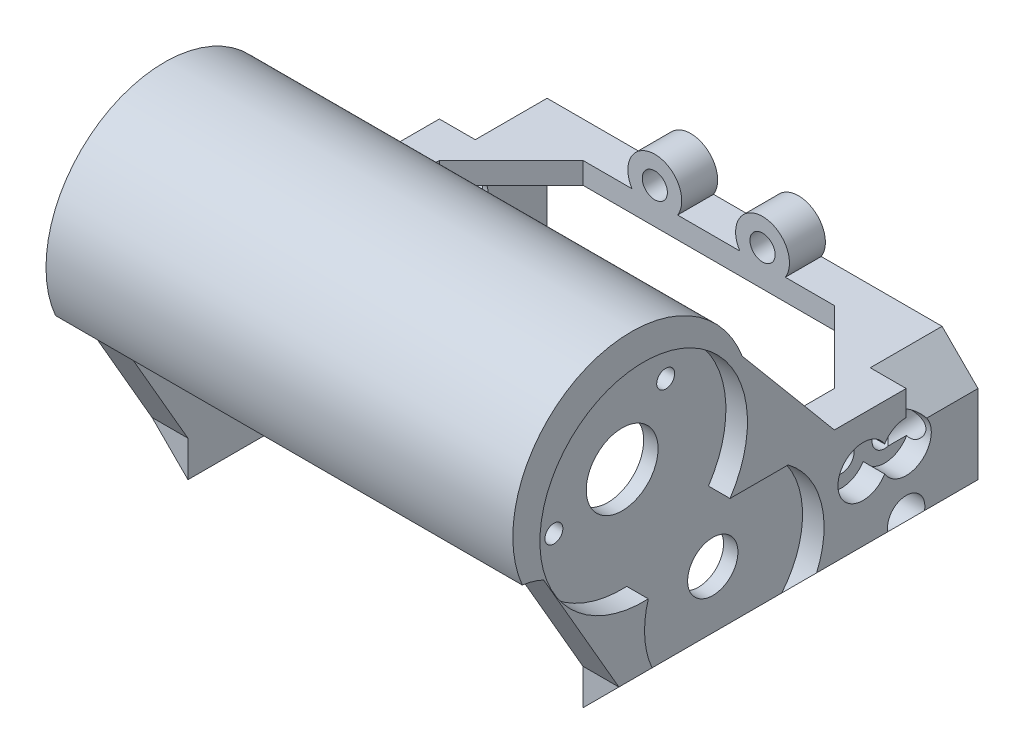
from build123d import *

# Parameters (mm, degrees)
SKETCH1_R           = 5
SKETCH1_R_2         = 1.25
SKETCH1_R_3         = 3.5
SKETCH1_R_4         = 1.75
SKETCH1_R_5         = 2.6
BOSS_EXTRUDE1_DEPTH = 5
CUT_EXTRUDE12_DEPTH = 3
CUT_EXTRUDE15_REACH = 72.749
BOSS_EXTRUDE2_START = -65
SKETCH7_W           = 5
SKETCH7_H           = 3
BOSS_EXTRUDE2_DEPTH = 65
SKETCH8_R           = 1.75
CUT_EXTRUDE16_DEPTH = 10
SKETCH10_R          = 3.75
SKETCH10_R_2        = 1.75
BOSS_EXTRUDE3_DEPTH = 5
CHAMFER1_SIZE       = 10


with BuildPart() as part:
    # Sketch1 → Boss-Extrude1 (new body)
    with BuildSketch(Plane(origin=(0, 0, 0), x_dir=(0, 0, -1), z_dir=(1, 0, 0))):
        with BuildLine():
            Line((-3.451085907, -28.022543867), (46.548914093, -28.022543867))
            Line((46.548914093, -28.022543867), (46.548914093, -7.022543867))
            Line((46.548914093, -7.022543867), (26.548914093, -7.022543867))
            Line((26.548914093, -7.022543867), (13.706594967, 8.30960665))
            ThreePointArc((13.706594967, 8.30960665), (-7.876735811, 17.766067564), (-16.904643834, -4))
            ThreePointArc((-16.904643834, -4), (-15.383939757, -4.319460395), (-13.931085907, -4.870651404))
            Line((-13.931085907, -4.870651404), (-3.451085907, -23.022543867))
            Line((-3.451085907, -23.022543867), (-3.451085907, -28.022543867))
        make_face()
        Circle(SKETCH1_R, mode=Mode.SUBTRACT)
        with Locations((6.061215112, 7.906432278)):
            Circle(SKETCH1_R_2, mode=Mode.SUBTRACT)
        with Locations((-9.50267373, -2.991520012)):
            Circle(SKETCH1_R_2, mode=Mode.SUBTRACT)
        with Locations((12.6186816, -18.021344974)):
            Circle(SKETCH1_R_3, mode=Mode.SUBTRACT)
        with Locations((36.548914093, -14.022543867)):
            Circle(SKETCH1_R_4, mode=Mode.SUBTRACT)
        with Locations((30.548914093, -14.022543867)):
            Circle(SKETCH1_R_4, mode=Mode.SUBTRACT)
        with Locations((36.548914093, -22.522543867)):
            Circle(SKETCH1_R_5, mode=Mode.SUBTRACT)
    boss_extrude1 = extrude(amount=BOSS_EXTRUDE1_DEPTH)

    # Sketch2 → Cut-Extrude12 (cut)
    with BuildSketch(Plane(origin=(5, 0, 0), x_dir=(0, 0, -1), z_dir=(1, 0, 0))):
        with BuildLine():
            Line((9.1186816, -30.021344974), (16.1186816, -30.021344974))
            ThreePointArc((16.1186816, -30.021344974), (24.917055476, -20.257412952), (20.1186816, -8.021344974))
            Line((20.1186816, -8.021344974), (12.019173216, -8.021344974))
            ThreePointArc((12.019173216, -8.021344974), (-7.097524936, 12.586804193), (0.644011182, -14.435641641))
            ThreePointArc((0.644011182, -14.435641641), (1.637110982, -23.992534703), (9.1186816, -30.021344974))
        make_face()
        with BuildLine():
            ThreePointArc((33.548914093, -15.825319505), (40.048914093, -14.022543867), (33.548914093, -12.219768229))
            ThreePointArc((33.548914093, -12.219768229), (27.048914093, -14.022543867), (33.548914093, -15.825319505))
        make_face()
    cut_extrude12 = extrude(amount=-CUT_EXTRUDE12_DEPTH, mode=Mode.SUBTRACT)

    # Sketch6 → Cut-Extrude15 (cut, up to next)
    with BuildSketch(Plane(origin=(0, 0, -46.548914093), x_dir=(-1, 0, 0), z_dir=(0, 0, -1)), mode=Mode.PRIVATE) as cut_extrude15_sk1:
        Polygon((0, -28.022543867), (-5, -23.022543867), (-6.777242855, -29.799786723), align=None)
    cut_extrude15_tool1 = extrude(cut_extrude15_sk1.sketch, amount=-CUT_EXTRUDE15_REACH, mode=Mode.PRIVATE) & part.part
    cut_extrude15 = cut_extrude15_tool1.solids().sort_by_distance((3.925748, -26.948291, -46.548914))[0]
    add(cut_extrude15, mode=Mode.SUBTRACT)

    # Sketch7 → Boss-Extrude2 (add)
    with BuildSketch(Plane(origin=(5, 0, 0), x_dir=(0, 0, -1), z_dir=(1, 0, 0)).offset(BOSS_EXTRUDE2_START)):
        with BuildLine():
            Line((-13.931085907, -4.870651404), (-13.604383665, -4.870651404))
            ThreePointArc((-13.604383665, -4.870651404), (-6.212314592, 13.046441944), (12.35657784, 7.491160397))
            Line((12.35657784, 7.491160397), (13.706594967, 8.30960665))
            ThreePointArc((13.706594967, 8.30960665), (-7.876735811, 17.766067564), (-16.904643834, -4))
            ThreePointArc((-16.904643834, -4), (-15.383939757, -4.319460395), (-13.931085907, -4.870651404))
        make_face()
        with Locations((44.048914093, -8.522543867)):
            Rectangle(SKETCH7_W, SKETCH7_H)
    extrude(amount=BOSS_EXTRUDE2_DEPTH)

    # Mirror4: Boss-Extrude1, Cut-Extrude12, Cut-Extrude15 across plane
    add(boss_extrude1.mirror(Plane(origin=(-27.5, 0, 0), x_dir=(0, 0, 1), z_dir=(1, 0, 0))))
    add(cut_extrude12.mirror(Plane(origin=(-27.5, 0, 0), x_dir=(0, 0, 1), z_dir=(1, 0, 0))), mode=Mode.SUBTRACT)
    add(cut_extrude15.mirror(Plane(origin=(-27.5, 0, 0), x_dir=(0, 0, 1), z_dir=(1, 0, 0))), mode=Mode.SUBTRACT)

    # Sketch8 → Cut-Extrude16 (cut)
    with BuildSketch(Plane(origin=(0, 0, -46.548914093), x_dir=(-1, 0, 0), z_dir=(0, 0, -1))):
        with Locations(Location((-2.5, -14.022543867, 0), (0, 0, 90))):
            Circle(SKETCH8_R)
        with Locations(Location((57.5, -14.022543867, 0), (0, 0, 90))):
            Circle(SKETCH8_R)
        Polygon((55, -7.022543867), (60, -12.022543867), (62.67758006, -4.344963807), align=None)
        Polygon((0, -7.022543867), (-5, -12.022543867), (-6.777064695, -5.245479172), align=None)
    extrude(amount=-CUT_EXTRUDE16_DEPTH, mode=Mode.SUBTRACT)

    # Sketch10 → Boss-Extrude3 (add)
    # profile 1 of 2: a face of its own
    with BuildSketch(Plane(origin=(0, 0, -46.548914093), x_dir=(-1, 0, 0), z_dir=(0, 0, -1))):
        with Locations((35, -5.022543867)):
            Circle(SKETCH10_R)
        with Locations(Location((35, -5.022543867, 0), (0, 0, 90))):
            Circle(SKETCH10_R_2, mode=Mode.SUBTRACT)
    # profile 2 of 2: a face of its own
    with BuildSketch(Plane(origin=(0, 0, -46.548914093), x_dir=(-1, 0, 0), z_dir=(0, 0, -1))):
        with Locations((20, -5.022543867)):
            Circle(SKETCH10_R)
        with Locations(Location((20, -5.022543867, 0), (0, 0, 90))):
            Circle(SKETCH10_R_2, mode=Mode.SUBTRACT)
    extrude(amount=-BOSS_EXTRUDE3_DEPTH)

    # Chamfer1
    # the kernel refuses this chamfer: 10 mm, written as the material it adds along each edge
    with BuildSketch(Plane(origin=(0, -10.022543867, -41.548914093), x_dir=(-0.9996219169112968, 0, -0.027495876610586317), z_dir=(0, 1, 0)), Plane(origin=(-55, -7.022543867, -41.548914093), x_dir=(0.9996219169112968, 0, -0.027495876610586317), z_dir=(0, -1, 0))) as chamfer1_piece_1:
        Polygon((CHAMFER1_SIZE * 0.999621916911, CHAMFER1_SIZE * 0.0274958766106), (-CHAMFER1_SIZE * 0.0274958766106, CHAMFER1_SIZE * 0.999621916911), (0, 0), align=None)
    extrude(amount=3)


solid = part.part
